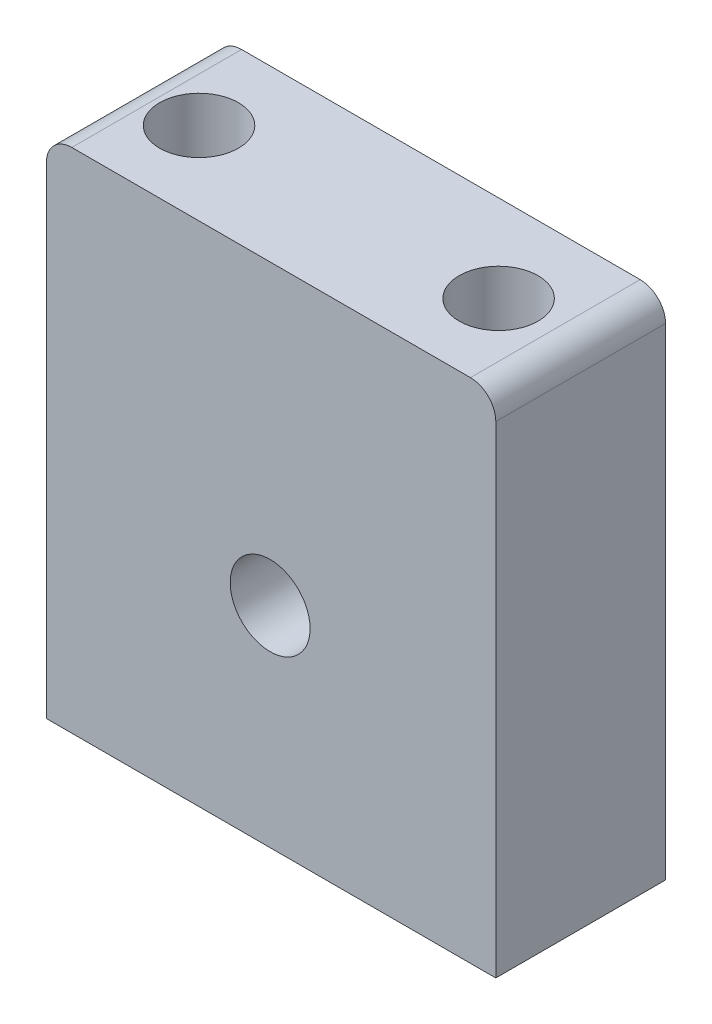
from build123d import *

# Parameters (mm, degrees)
SKETCH1_W           = 45
SKETCH1_H           = 50.8
SKETCH1_R           = 4
BOSS_EXTRUDE1_DEPTH = 17
SKETCH2_R           = 3.95
CUT_EXTRUDE1_DEPTH  = 17
FILLET1_R           = 2.54


with BuildPart() as part:
    # Sketch1 → Boss-Extrude1 (new body)
    with BuildSketch(Plane.XY):
        with Locations((22.5, 25.4)):
            Rectangle(SKETCH1_W, SKETCH1_H)
        with Locations((22.4, 21)):
            Circle(SKETCH1_R, mode=Mode.SUBTRACT)
    extrude(amount=BOSS_EXTRUDE1_DEPTH)

    # Sketch2 → Cut-Extrude1 (cut)
    with BuildSketch(Plane(origin=(0, 50.8, 0), x_dir=(1, 0, 0), z_dir=(0, 1, 0))):
        with Locations((7, -8.718619698)):
            Circle(SKETCH2_R)
        with Locations((37, -8.718619698)):
            Circle(SKETCH2_R)
    extrude(amount=-CUT_EXTRUDE1_DEPTH, mode=Mode.SUBTRACT)

    # Fillet1
    fillet1_edges = [part.edges().sort_by_distance(p)[0] for p in [
        (0, 50.8, 8.5),
        (45, 50.8, 8.5),
    ]]
    fillet(fillet1_edges, radius=FILLET1_R)


solid = part.part
